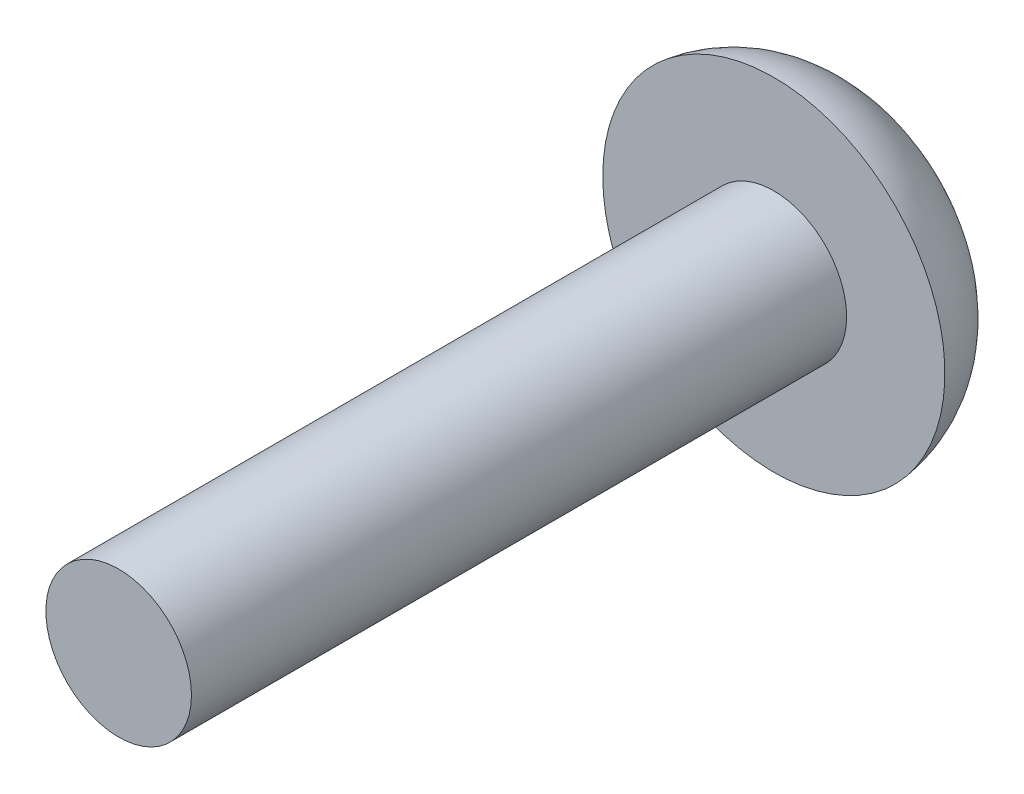
from build123d import *

# Parameters (mm, degrees)
SKETCH_1_R      = 2
EXTRUDE_1_DEPTH = 18
SKETCH_2_R      = 4.7
EXTRUDE_2_DEPTH = 2.65
FILLET_2_R      = 3


with BuildPart() as part:
    # 草图1 → 凸台-拉伸1 (new body)
    with BuildSketch(Plane.XY):
        Circle(SKETCH_1_R)
    extrude(amount=EXTRUDE_1_DEPTH)

    # 草图2 → 凸台-拉伸2 (add)
    with BuildSketch(Plane(origin=(0, 0, 0), x_dir=(-1, 0, 0), z_dir=(0, 0, -1))):
        Circle(SKETCH_2_R)
    extrude(amount=EXTRUDE_2_DEPTH)

    # 圆角2
    # the kernel refuses this fillet: 3 mm, written as the material it takes off along each edge
    with BuildSketch(Plane(origin=(0, 0, -2.65), x_dir=(-1, 0, 0), z_dir=(0, -1, 0))) as fillet_2_piece_1:
        with BuildLine():
            CenterArc((1.720486617, -3), FILLET_2_R, 6.699765178, 83.300234822)
            Line((1.720486617, 0), (1.720486617, 0.06))
            Line((1.720486617, 0.06), (4.7, 0.06))
            Line((4.7, 0.06), (4.76, 0))
            ThreePointArc((4.76, 0), (4.76, -1.325), (4.759590268, -2.643))
            Line((4.759590268, -2.643), (4.7, -2.65))
        make_face()
    revolve(axis=Axis((0, 0, -2.65), (0, 0, -1)), mode=Mode.SUBTRACT)


solid = part.part
